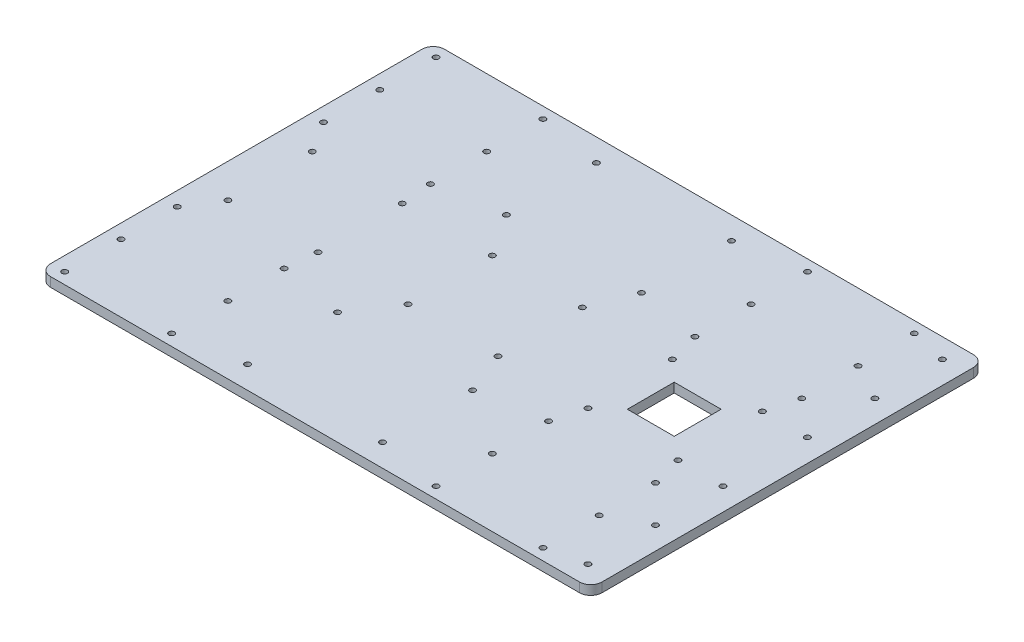
from build123d import *

# Parameters (mm, degrees)
SKETCH1_R           = 1.5
SKETCH1_W           = 25
SKETCH1_H           = 25
BOSS_EXTRUDE1_DEPTH = 5


with BuildPart() as part:
    # Sketch1 → Boss-Extrude1 (new body)
    with BuildSketch(Plane(origin=(0, 0, 0), x_dir=(1, 0, 0), z_dir=(0, 1, 0))):
        with BuildLine():
            Line((-129, -105), (129, -105))
            Line((129, -105), (153, -105))
            ThreePointArc((153, -105), (157.242640687, -103.242640687), (159, -99))
            Line((159, -99), (159, 99))
            ThreePointArc((159, 99), (157.242640687, 103.242640687), (153, 105))
            Line((153, 105), (129, 105))
            Line((129, 105), (-129, 105))
            ThreePointArc((-129, 105), (-133.242640687, 103.242640687), (-135, 99))
            Line((-135, 99), (-135, -99))
            ThreePointArc((-135, -99), (-133.242640687, -103.242640687), (-129, -105))
        make_face()
        with Locations((-127.5, 99)):
            Circle(SKETCH1_R, mode=Mode.SUBTRACT)
        with Locations((-127.5, 69)):
            Circle(SKETCH1_R, mode=Mode.SUBTRACT)
        with Locations((-127.5, 39)):
            Circle(SKETCH1_R, mode=Mode.SUBTRACT)
        with Locations((-70.5, 99)):
            Circle(SKETCH1_R, mode=Mode.SUBTRACT)
        with Locations((-70.5, 69)):
            Circle(SKETCH1_R, mode=Mode.SUBTRACT)
        with Locations((-70.5, 39)):
            Circle(SKETCH1_R, mode=Mode.SUBTRACT)
        with Locations((70.5, 39)):
            Circle(SKETCH1_R, mode=Mode.SUBTRACT)
        with Locations((70.5, 69)):
            Circle(SKETCH1_R, mode=Mode.SUBTRACT)
        with Locations((70.5, 99)):
            Circle(SKETCH1_R, mode=Mode.SUBTRACT)
        with Locations((127.5, 39)):
            Circle(SKETCH1_R, mode=Mode.SUBTRACT)
        with Locations((127.5, 69)):
            Circle(SKETCH1_R, mode=Mode.SUBTRACT)
        with Locations((127.5, 99)):
            Circle(SKETCH1_R, mode=Mode.SUBTRACT)
        with Locations((127.5, -99)):
            Circle(SKETCH1_R, mode=Mode.SUBTRACT)
        with Locations((127.5, -69)):
            Circle(SKETCH1_R, mode=Mode.SUBTRACT)
        with Locations((127.5, -39)):
            Circle(SKETCH1_R, mode=Mode.SUBTRACT)
        with Locations((70.5, -99)):
            Circle(SKETCH1_R, mode=Mode.SUBTRACT)
        with Locations((70.5, -69)):
            Circle(SKETCH1_R, mode=Mode.SUBTRACT)
        with Locations((70.5, -39)):
            Circle(SKETCH1_R, mode=Mode.SUBTRACT)
        with Locations((-70.5, -39)):
            Circle(SKETCH1_R, mode=Mode.SUBTRACT)
        with Locations((-70.5, -69)):
            Circle(SKETCH1_R, mode=Mode.SUBTRACT)
        with Locations((-70.5, -99)):
            Circle(SKETCH1_R, mode=Mode.SUBTRACT)
        with Locations((-127.5, -39)):
            Circle(SKETCH1_R, mode=Mode.SUBTRACT)
        with Locations((-127.5, -69)):
            Circle(SKETCH1_R, mode=Mode.SUBTRACT)
        with Locations((-127.5, -99)):
            Circle(SKETCH1_R, mode=Mode.SUBTRACT)
        with Locations((147, -94.5)):
            Circle(SKETCH1_R, mode=Mode.SUBTRACT)
        with Locations((147, -58.5)):
            Circle(SKETCH1_R, mode=Mode.SUBTRACT)
        with Locations((147, -22.5)):
            Circle(SKETCH1_R, mode=Mode.SUBTRACT)
        with Locations((123, -22.5)):
            Circle(SKETCH1_R, mode=Mode.SUBTRACT)
        with Locations((75, -22.5)):
            Circle(SKETCH1_R, mode=Mode.SUBTRACT)
        with Locations((27, -22.5)):
            Circle(SKETCH1_R, mode=Mode.SUBTRACT)
        with Locations((-21, -22.5)):
            Circle(SKETCH1_R, mode=Mode.SUBTRACT)
        with Locations((-69, -22.5)):
            Circle(SKETCH1_R, mode=Mode.SUBTRACT)
        with Locations((-117, -22.5)):
            Circle(SKETCH1_R, mode=Mode.SUBTRACT)
        with Locations((-36, -93)):
            Circle(SKETCH1_R, mode=Mode.SUBTRACT)
        with Locations((36, -93)):
            Circle(SKETCH1_R, mode=Mode.SUBTRACT)
        with Locations((36, -45)):
            Circle(SKETCH1_R, mode=Mode.SUBTRACT)
        with Locations((-36, -45)):
            Circle(SKETCH1_R, mode=Mode.SUBTRACT)
        with Locations((123, 22.5)):
            Circle(SKETCH1_R, mode=Mode.SUBTRACT)
        with Locations((75, 22.5)):
            Circle(SKETCH1_R, mode=Mode.SUBTRACT)
        with Locations((27, 22.5)):
            Circle(SKETCH1_R, mode=Mode.SUBTRACT)
        with Locations((-21, 22.5)):
            Circle(SKETCH1_R, mode=Mode.SUBTRACT)
        with Locations((-69, 22.5)):
            Circle(SKETCH1_R, mode=Mode.SUBTRACT)
        with Locations((-117, 22.5)):
            Circle(SKETCH1_R, mode=Mode.SUBTRACT)
        with Locations((36, 93)):
            Circle(SKETCH1_R, mode=Mode.SUBTRACT)
        with Locations((36, 45)):
            Circle(SKETCH1_R, mode=Mode.SUBTRACT)
        with Locations((-36, 45)):
            Circle(SKETCH1_R, mode=Mode.SUBTRACT)
        with Locations((-36, 93)):
            Circle(SKETCH1_R, mode=Mode.SUBTRACT)
        with Locations((147, 94.5)):
            Circle(SKETCH1_R, mode=Mode.SUBTRACT)
        with Locations((147, 58.5)):
            Circle(SKETCH1_R, mode=Mode.SUBTRACT)
        with Locations((147, 22.5)):
            Circle(SKETCH1_R, mode=Mode.SUBTRACT)
        with Locations((98.5, 0)):
            Rectangle(SKETCH1_W, SKETCH1_H, mode=Mode.SUBTRACT)
    extrude(amount=BOSS_EXTRUDE1_DEPTH)


solid = part.part
